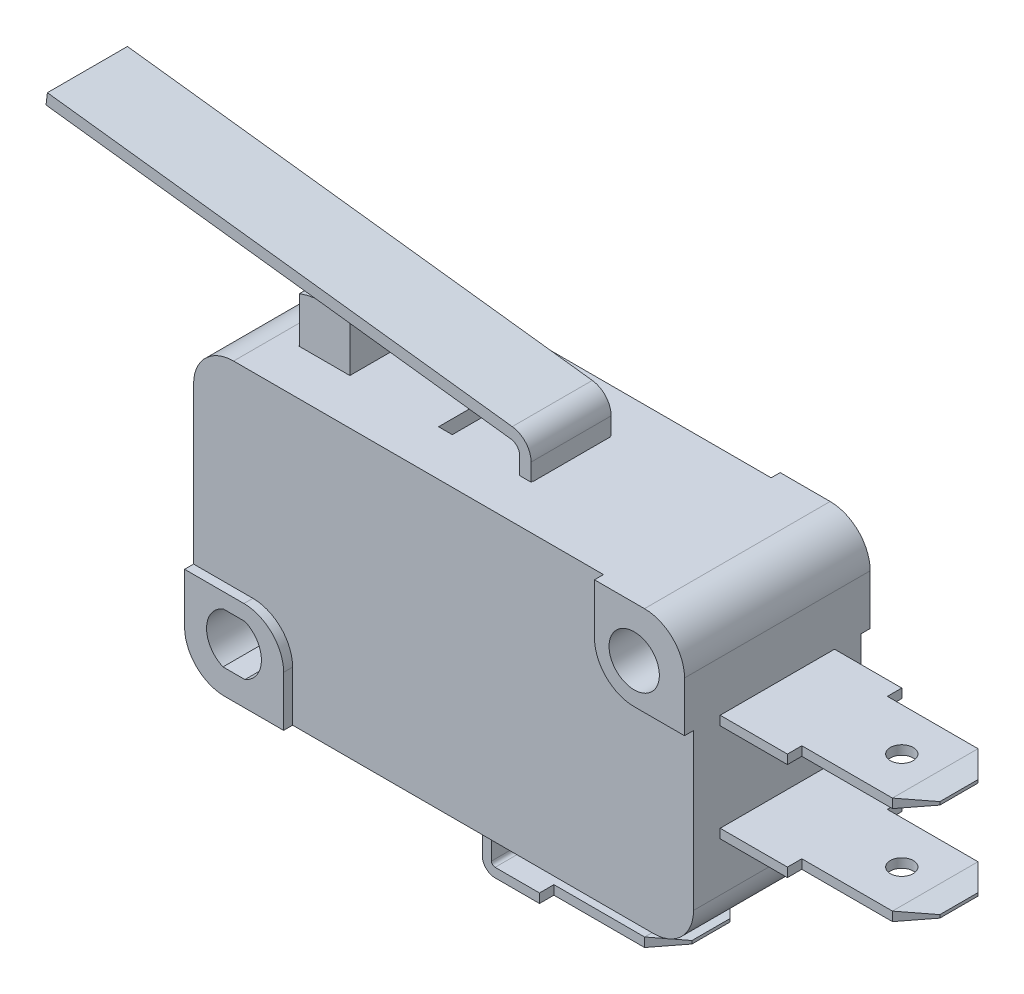
from build123d import *

# Parameters (mm, degrees)
SKETCH1_W               = 27.7622
SKETCH1_H               = 15.875
SKETCH1_R               = 1.397
EXTRUDE1_DEPTH          = 5.155
FILLET1_R               = 2.2225
EXTRUDE2_DEPTH          = 2.1
SKETCH3_W               = 2.8508
SKETCH3_H               = 4.2508
SKETCH3_W_2             = 0.762
CUT_EXTRUDE1_DEPTH      = 2
CUT_EXTRUDE2_DEPTH      = 0.5
EXTRUDE3_DEPTH          = 3.175
SKETCH6_R               = 0.635
CUT_EXTRUDE3_DEPTH      = 26.970827061
EXTRUDE4_START          = -5.5118
EXTRUDE4_OUTLINE_R      = 0.635
EXTRUDE4_DEPTH          = 0.508
LPATTERN1_COUNT         = 2
LPATTERN1_PITCH         = 5.4356
CUT_EXTRUDE4_DEPTH      = 27.924770629
CUT_EXTRUDE4_DEPTH_BACK = 27.924770629
BODY_MOVE_COPY2_START   = -2.2225
BODY_MOVE_COPY2_DEPTH   = 4.445


# Read off the part's stored shape, not the designer's step: Extrude4, Body-Move/Copy2
with BuildPart() as part:
    # Sketch1 → Extrude1 (new, symmetric)
    with BuildSketch(Plane.XY):
        Rectangle(SKETCH1_W, SKETCH1_H)
        with Locations((11.0871, 5.1435)):
            Circle(SKETCH1_R, mode=Mode.SUBTRACT)
        with BuildLine():
            Line((-11.746970603, -3.7719), (-10.528829397, -3.7719))
            ThreePointArc((-10.528829397, -3.7719), (-9.6139, -5.1689), (-10.528829397, -6.5659))
            Line((-10.528829397, -6.5659), (-11.746970603, -6.5659))
            ThreePointArc((-11.746970603, -6.5659), (-12.6619, -5.1689), (-11.746970603, -3.7719))
        make_face(mode=Mode.SUBTRACT)
    extrude(amount=EXTRUDE1_DEPTH, both=True)

    # Fillet1
    fillet1_edges = [part.edges().sort_by_distance(p)[0] for p in [
        (-13.8811, 7.9375, 0),
        (13.8811, 7.9375, 0),
        (13.8811, -7.9375, 0),
        (-13.8811, -7.9375, 0),
    ]]
    fillet(fillet1_edges, radius=FILLET1_R)

    # Sketch3 → Cut-Extrude1 (cut)
    with BuildSketch(Plane(origin=(0, 7.9375, 0), x_dir=(-1, 0, 0), z_dir=(0, 1, 0))):
        with Locations((9.1567, 0)):
            Rectangle(SKETCH3_W, SKETCH3_H)
        with Locations((2.4257, 0)):
            Rectangle(SKETCH3_W_2, SKETCH3_H)
        with Locations((-2.0701, 0)):
            Rectangle(SKETCH3_W_2, SKETCH3_H)
    extrude(amount=-CUT_EXTRUDE1_DEPTH, mode=Mode.SUBTRACT)

    # Sketch4 → Cut-Extrude2 (cut)
    with BuildSketch(Plane.XY.offset(5.155)):
        with BuildLine():
            Line((-8.3811, -7.9375), (13.8811, -7.9375))
            Line((13.8811, -7.9375), (13.8811, 2.9375))
            Line((13.8811, 2.9375), (11.0871, 2.9375))
            ThreePointArc((11.0871, 2.9375), (9.527222441, 3.583622441), (8.8811, 5.1435))
            Line((8.8811, 5.1435), (8.8811, 7.9375))
            Line((8.8811, 7.9375), (-13.8811, 7.9375))
            Line((-13.8811, 7.9375), (-13.8811, -2.9375))
            Line((-13.8811, -2.9375), (-10.5871, -2.9375))
            ThreePointArc((-10.5871, -2.9375), (-9.027222441, -3.583622441), (-8.3811, -5.1435))
            Line((-8.3811, -5.1435), (-8.3811, -7.9375))
        make_face()
    cut_extrude2 = extrude(amount=-CUT_EXTRUDE2_DEPTH, mode=Mode.SUBTRACT)

    # Mirror1: Cut-Extrude2 across plane
    add(cut_extrude2.mirror(Plane.XY), mode=Mode.SUBTRACT)

    # Sketch5 → Extrude3 (add, symmetric)
    with BuildSketch(Plane.XY):
        with BuildLine():
            Line((0.6731, -7.9375), (0.6731, -10.4299))
            ThreePointArc((0.6731, -10.4299), (0.880468399, -10.930531601), (1.3811, -11.1379))
            Line((1.3811, -11.1379), (10.1981, -11.1379))
            Line((10.1981, -11.1379), (10.1981, -10.6299))
            Line((10.1981, -10.6299), (1.3811, -10.6299))
            ThreePointArc((1.3811, -10.6299), (1.239678644, -10.571321356), (1.1811, -10.4299))
            Line((1.1811, -10.4299), (1.1811, -7.9375))
            Line((1.1811, -7.9375), (0.6731, -7.9375))
        make_face()
    extrude(amount=EXTRUDE3_DEPTH, both=True)

    # Sketch6 → Cut-Extrude3 (cut, through all)
    with BuildSketch(Plane(origin=(0, -10.6299, 0), x_dir=(-1, 0, 0), z_dir=(0, 1, 0))):
        with Locations((-7.0231, 0)):
            Circle(SKETCH6_R)
        Polygon((-10.1981, 1.058333333), (-8.881533333, 2.3749), (-3.8481, 2.3749), (-3.8481, 3.175), (-10.1981, 3.175), align=None)
        Polygon((-10.1981, -3.175), (-10.1981, -1.058333333), (-8.881533333, -2.3749), (-3.8481, -2.3749), (-3.8481, -3.175), align=None)
    extrude(amount=-CUT_EXTRUDE3_DEPTH, mode=Mode.SUBTRACT)

    # Extrude4 outline → Extrude4 (add)
    with BuildSketch(Plane(origin=(0, 7.9375, 0), x_dir=(-1, 0, 0), z_dir=(0, 1, 0)).offset(EXTRUDE4_START)):
        Polygon((-13.8811, -3.175), (-13.8811, 3.175), (-17.6149, 3.175), (-17.6149, 2.3749), (-22.648333333, 2.3749), (-23.9649, 1.058333333), (-23.9649, -1.058333333), (-22.648333333, -2.3749), (-17.6149, -2.3749), (-17.6149, -3.175), align=None)
        with Locations((-20.7899, 0)):
            Circle(EXTRUDE4_OUTLINE_R, mode=Mode.SUBTRACT)
    extrude4 = extrude(amount=EXTRUDE4_DEPTH)

    # LPattern1: Extrude4 ×2
    with Locations(*[(0, -i * LPATTERN1_PITCH, 0) for i in range(1, LPATTERN1_COUNT)]):
        add(extrude4)

    # Sketch7 → Cut-Extrude4 (cut, two sides: drawn at the far end of the back side and taken through both)
    with BuildSketch(Plane.XY.offset(-CUT_EXTRUDE4_DEPTH_BACK)):
        Polygon((8.881533333, -10.6299), (10.1981, -10.6299), (10.1981, -10.799233333), align=None)
        Polygon((8.881533333, -11.1379), (10.1981, -11.1379), (10.1981, -10.968566667), align=None)
        Polygon((22.648333333, 2.9337), (23.9649, 2.764366667), (23.9649, 2.9337), align=None)
        Polygon((23.9649, 2.595033333), (22.648333333, 2.4257), (23.9649, 2.4257), align=None)
        Polygon((22.648333333, -2.5019), (23.9649, -2.5019), (23.9649, -2.671233333), align=None)
        Polygon((23.9649, -2.840566667), (22.648333333, -3.0099), (23.9649, -3.0099), align=None)
    extrude(amount=CUT_EXTRUDE4_DEPTH + CUT_EXTRUDE4_DEPTH_BACK, mode=Mode.SUBTRACT)


with BuildPart() as body_2:
    # Sketch2 → Extrude2 (new, symmetric)
    with BuildSketch(Plane.XY):
        with BuildLine():
            Line((-10.5567, 7.278098799), (-10.5567, 10.453098799))
            ThreePointArc((-10.5567, 10.453098799), (-9.1567, 10.7061), (-7.7567, 10.453098799))
            Line((-7.7567, 10.453098799), (-7.7567, 7.278098799))
            Line((-7.7567, 7.278098799), (-10.5567, 7.278098799))
        make_face()
    extrude(amount=EXTRUDE2_DEPTH, both=True)


with BuildPart() as body_3:
    # Body-Move/Copy2 outline → Body-Move/Copy2 (new body)
    with BuildSketch(Plane.XY.offset(BODY_MOVE_COPY2_START)):
        with BuildLine():
            Line((1.793875, 7.271748799), (2.428875, 7.271748799))
            Line((2.428875, 7.271748799), (2.428875, 8.905227531))
            ThreePointArc((2.428875, 8.905227531), (2.129720805, 9.694447205), (1.38258806, 10.087071181))
            Line((1.38258806, 10.087071181), (-24.431625, 13.23975))
            Line((-24.431625, 13.23975), (-24.508605299, 12.609433386))
            Line((-24.508605299, 12.609433386), (1.305607762, 9.456754568))
            ThreePointArc((1.305607762, 9.456754568), (1.654269709, 9.273530045), (1.793875, 8.905227531))
            Line((1.793875, 8.905227531), (1.793875, 7.271748799))
        make_face()
    extrude(amount=BODY_MOVE_COPY2_DEPTH)


solid = Compound([part.part, body_2.part, body_3.part])
